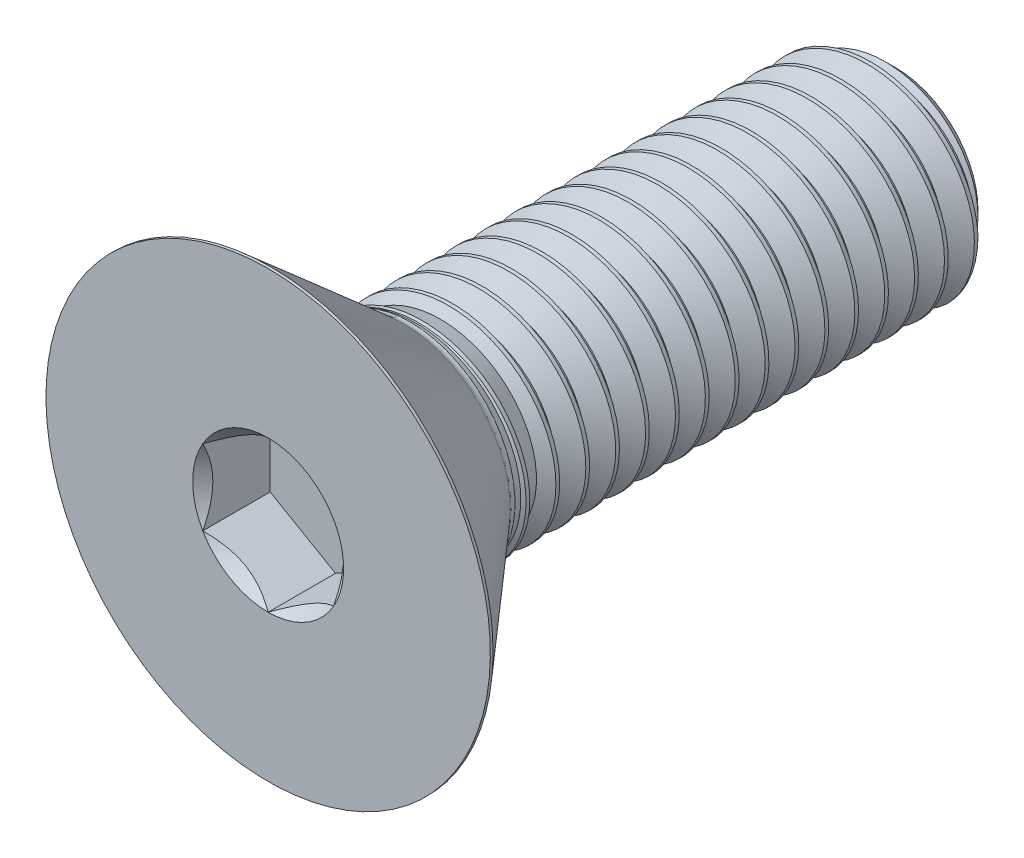
from build123d import *

# Parameters (mm, degrees)
SKETCH10_R         = 2.291358881
CUT_EXTRUDE2_DEPTH = 2.0447
CUT_EXTRUDE2_DRAFT = -45
CUT_EXTRUDE1_DEPTH = 2.0447
CUT_SWEEP1_PITCH   = 0.907142857
CUT_SWEEP1_TO      = 14.733428


with BuildPart() as part:
    # Sketch2 → Revolve1 (revolve)
    with BuildSketch(Plane(origin=(0, 0, 0), x_dir=(0, 0, -1), z_dir=(1, 0, 0))):
        with BuildLine():
            Line((-9.443212, 6.7437), (-5.4356, 3.259936038))
            ThreePointArc((-5.4356, 3.259936038), (-5.329693592, 3.196928347), (-5.208428247, 3.175))
            Line((-5.208428247, 3.175), (8.844642857, 3.175))
            Line((8.844642857, 3.175), (9.525, 2.494642857))
            Line((9.525, 2.494642857), (9.525, 0))
            Line((9.525, 0), (-9.525, 0))
            Line((-9.525, 0), (-9.525, 6.7437))
            Line((-9.525, 6.7437), (-9.443212, 6.7437))
        make_face()
    revolve(axis=Axis((0, 0, -9.525), (0, 0, 1)))


with BuildPart() as cut_extrude2_tool:
    # Sketch10 → Cut-Extrude2 (with draft: the straight prism first)
    with BuildSketch(Plane.XY.offset(9.525)):
        Circle(SKETCH10_R)
    extrude(amount=-CUT_EXTRUDE2_DEPTH)
    # Cut-Extrude2: the draft: its side faces are tilted about the plane it starts from
    cut_extrude2_sides = [cut_extrude2_tool.faces().sort_by_distance(p)[0] for p in [
        (-2.291358881, 0, 8.50265),
    ]]
    draft(cut_extrude2_sides, Plane.XY.offset(9.525), CUT_EXTRUDE2_DRAFT)


with BuildPart() as part_1:
    add(part.part)

    # Cut-Extrude2: cut by cut_extrude2_tool
    add(cut_extrude2_tool.part, mode=Mode.SUBTRACT)

    # Sketch9 → Cut-Extrude1 (cut)
    with BuildSketch(Plane.XY.offset(9.525)):
        Polygon((1.984375, -1.14567944), (1.984375, 1.14567944), (0, 2.291358881), (-1.984375, 1.14567944), (-1.984375, -1.14567944), (0, -2.291358881), align=None)
    extrude(amount=-CUT_EXTRUDE1_DEPTH, mode=Mode.SUBTRACT)


with BuildPart() as body_2:
    # Split1: the piece on the far side of the plane
    add(part_1.part)
    split(bisect_by=Plane.XY.offset(5.208428247), keep=Keep.BOTTOM)

    # Cut-Sweep1: arcs per turn and ends read off the stored shape
    # Cut-Sweep1: the profile of Sketch4 screwed along a right-hand helix through 21 turns, 8 arcs to a turn; built about Z, then put on its axis
    cut_sweep1_z = Axis((0, 0, 0), (0, 0, 1))
    cut_sweep1_corners = [(3.224100547, 0, 0.028348214), (3.224100547, 0, -0.822098214), (2.585793431, 0, -0.453571429), (2.585793431, 0, -0.340178571)]
    with BuildLine(mode=Mode.PRIVATE) as cut_sweep1_profile:
        Line(cut_sweep1_corners[0], cut_sweep1_corners[1])
        Line(cut_sweep1_corners[1], cut_sweep1_corners[2])
        Line(cut_sweep1_corners[2], cut_sweep1_corners[3])
        Line(cut_sweep1_corners[3], cut_sweep1_corners[0])
    cut_sweep1_cap = Face(cut_sweep1_profile.wire())
    cut_sweep1_turn_angles = [0, 22.5, 45, 67.5, 90, 112.5, 135, 157.5, 180, 202.5, 225, 247.5, 270, 292.5, 315, 337.5, 360]
    cut_sweep1_turn_weights = [1, 0.9238795325112867, 1, 0.9238795325112867, 1, 0.9238795325112867, 1, 0.9238795325112867, 1, 0.9238795325112867, 1, 0.9238795325112867, 1, 0.9238795325112867, 1, 0.9238795325112867, 1]
    cut_sweep1_turn_rails = [Edge.make_bspline([Vector(p[0], p[1], 0).rotate(cut_sweep1_z, cut_sweep1_turn_angles[k]) / cut_sweep1_turn_weights[k] + Vector(0, 0, p[2] + CUT_SWEEP1_PITCH * cut_sweep1_turn_angles[k] / 360) for k in range(17)], [0, 0, 0, 1, 1, 2, 2, 3, 3, 4, 4, 5, 5, 6, 6, 7, 7, 8, 8, 8], 2, cut_sweep1_turn_weights) for p in cut_sweep1_corners]
    cut_sweep1_turn_sides = [Face.make_surface_from_curves(cut_sweep1_turn_rails[p[0]], cut_sweep1_turn_rails[p[1]]) for p in [(0, 1), (1, 2), (2, 3), (3, 0)]]
    cut_sweep1 = Plane(origin=(0, 0, -9.525), x_dir=(0, 1, 0), z_dir=(0, 0, 1)) * split(Solid(Shell([*[p.moved(Location((0, 0, CUT_SWEEP1_PITCH * i))) for i in range(21) for p in cut_sweep1_turn_sides], cut_sweep1_cap, cut_sweep1_cap.rotate(cut_sweep1_z, 7560).moved(Location((0, 0, CUT_SWEEP1_PITCH * 7560 / 360)))])), bisect_by=Plane.XY.offset(CUT_SWEEP1_TO), keep=Keep.BOTTOM, mode=Mode.PRIVATE)
    add(cut_sweep1, mode=Mode.SUBTRACT)


with BuildPart() as part_2:
    add(part_1.part)

    # Split1
    split(bisect_by=Plane.XY.offset(5.208428247), keep=Keep.TOP)

    add(body_2.part)  # Boss-Extrude2 merges body 2
    # Boss-Extrude2 cone 1 section (through the dimple's axis) → Boss-Extrude2 (revolve)
    with BuildSketch(Plane(origin=(0, 0, 5.208428247), x_dir=(0, -1, 0), z_dir=(1, 0, 0))):
        Polygon((0, 0), (3.175, 0), (0, 8.723240807), align=None)
    revolve(axis=Axis((0, 0, 5.208428247), (0, 0, -1)))


solid = part_2.part
